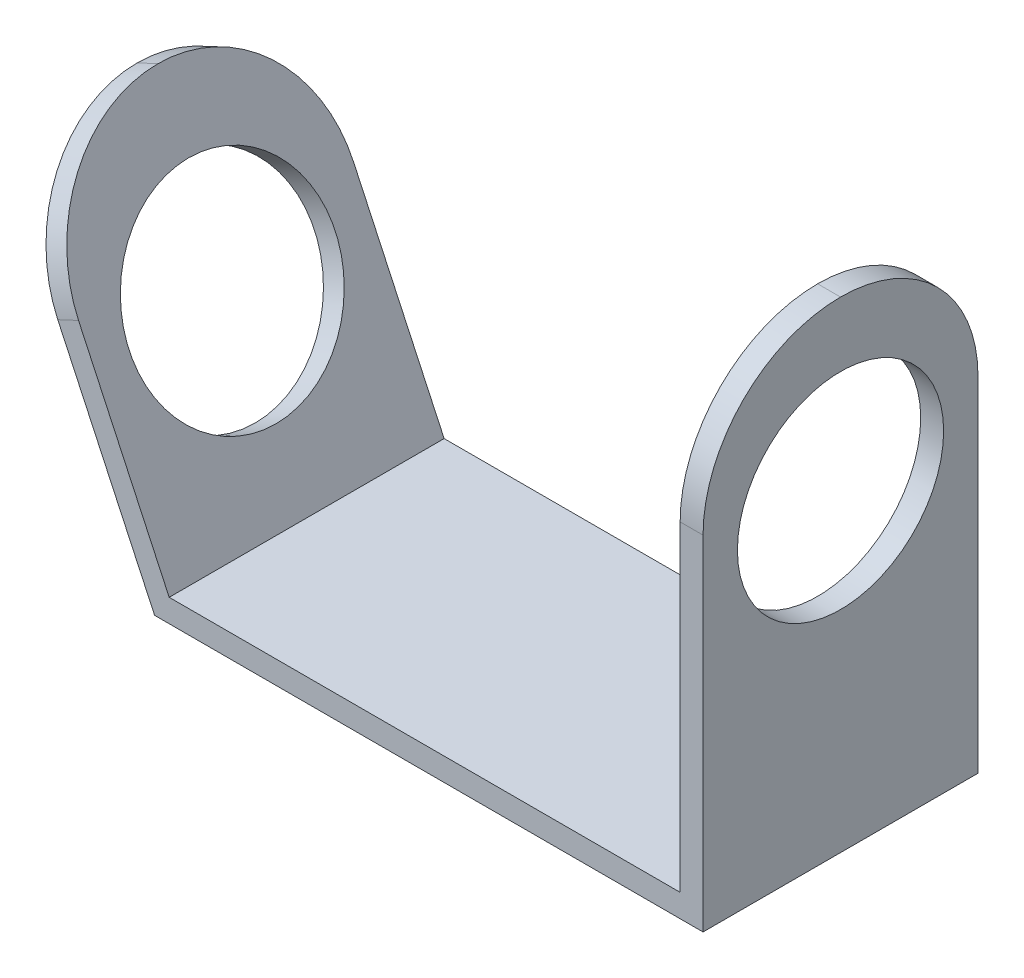
from build123d import *

# Parameters (mm, degrees)
SALIENTE_EXTRUIR1_DEPTH      = 110
SALIENTE_EXTRUIR1_DEPTH_BACK = 10
CROQUIS2_R                   = 45
CORTAR_EXTRUIR1_DEPTH        = 100
CROQUIS3_R                   = 45
CORTAR_EXTRUIR2_DEPTH        = 100
FILLET1_R                    = 60


with BuildPart() as part:
    # Croquis1 → Saliente-Extruir1 (new, two sides: drawn at the far end of the back side and taken through both)
    with BuildSketch(Plane.XY.offset(-SALIENTE_EXTRUIR1_DEPTH_BACK)):
        Polygon((-306.989624487, 145.009245926), (-239.370702608, 0), (0, 0), (0, 210), (-10, 210), (-10, 10), (-233, 10), (-297.926546616, 149.235428543), align=None)
    extrude(amount=SALIENTE_EXTRUIR1_DEPTH + SALIENTE_EXTRUIR1_DEPTH_BACK)

    # Croquis2 → Cortar-Extruir1 (cut)
    with BuildSketch(Plane.ZY.offset(10)):
        with Locations((50, 136.841249694)):
            Circle(CROQUIS2_R)
    extrude(amount=-CORTAR_EXTRUIR1_DEPTH, mode=Mode.SUBTRACT)

    # Croquis3 → Cortar-Extruir2 (cut)
    with BuildSketch(Plane(origin=(-187.554534313, -87.458115672, 0), x_dir=(0, 0, -1), z_dir=(0.906307787036651, 0.4226182617406971, 0))):
        with Locations(Location((-50, 184.347781552, 0), (0, 0, 90))):
            Circle(CROQUIS3_R)
    extrude(amount=-CORTAR_EXTRUIR2_DEPTH, mode=Mode.SUBTRACT)

    # Fillet1
    fillet1_edges = [part.edges().sort_by_distance(p)[0] for p in [
        (-5, 210, 110),
        (-5, 210, -10),
        (-302.458085551, 147.122337235, -10),
        (-302.458085551, 147.122337235, 110),
    ]]
    fillet(fillet1_edges, radius=FILLET1_R - 0.0001)  # a hair under: the kernel refuses the full size


solid = part.part
